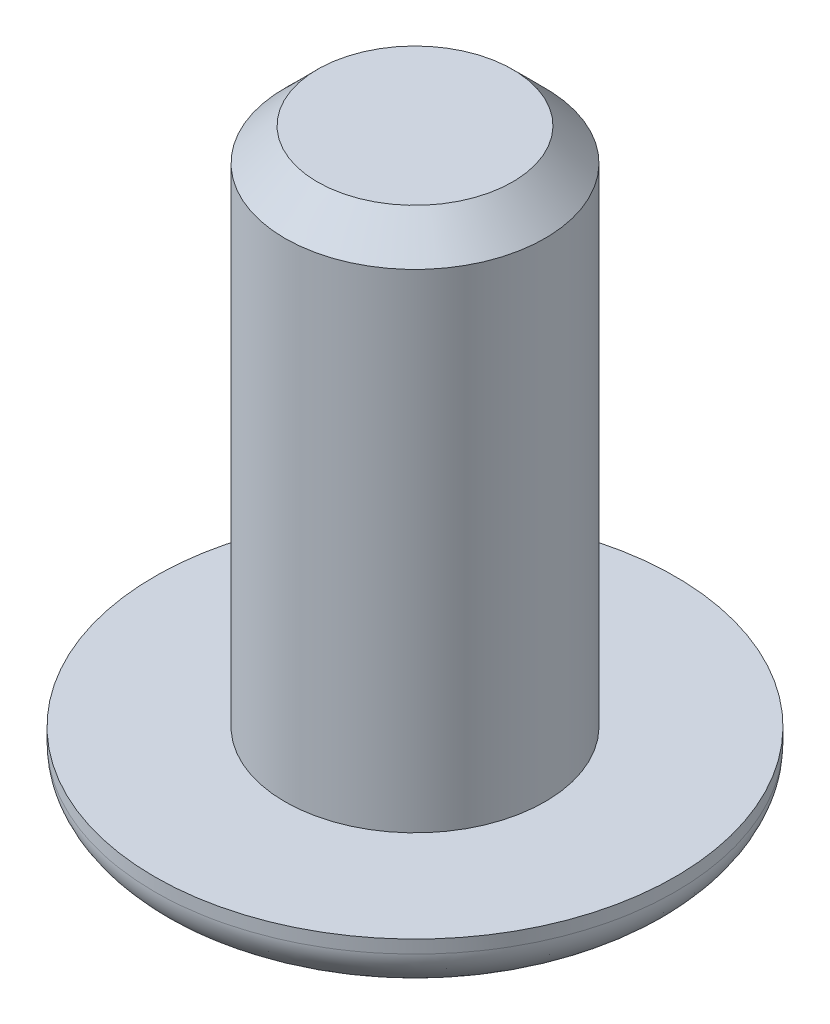
from build123d import *

# Parameters (mm, degrees)
SKETCH_1_R      = 4
EXTRUDE_1_DEPTH = 1.2
SKETCH_2_R      = 2
EXTRUDE_2_DEPTH = 8
CHAMFER_1_SIZE  = 0.5
FILLET_1_SIZE   = 1
FILLET_1_SIZE_2 = 2


with BuildPart() as part:
    # 草图1 → 凸台-拉伸1 (new body)
    with BuildSketch(Plane(origin=(0, 0, 0), x_dir=(1, 0, 0), z_dir=(0, 1, 0))):
        with Locations(Location((0, 0, 0), (0, 0, 270))):
            Circle(SKETCH_1_R)
        Polygon((1.443375673, 0), (0.721687836, 1.25), (-0.721687836, 1.25), (-1.443375673, 0), (-0.721687836, -1.25), (0.721687836, -1.25), align=None, mode=Mode.SUBTRACT)
    extrude(amount=EXTRUDE_1_DEPTH)

    # 草图2 → 凸台-拉伸2 (add)
    with BuildSketch(Plane(origin=(0, 1.2, 0), x_dir=(1, 0, 0), z_dir=(0, 1, 0))):
        with Locations(Location((0, 0, 0), (0, 0, 270))):
            Circle(SKETCH_2_R)
    extrude(amount=EXTRUDE_2_DEPTH)

    # 倒角1
    chamfer_1_edges = [part.edges().sort_by_distance(p)[0] for p in [
        (0, 9.2, -2),
    ]]
    chamfer(chamfer_1_edges, length=CHAMFER_1_SIZE)

    # 圆角1
    # an asymmetric fillet: 2, 1 mm, written as the material it takes off along each edge
    with BuildSketch(Plane(origin=(0, 0, 0), x_dir=(0, 0, 1), z_dir=(-1, 0, 0))) as fillet_1_piece_1:
        with BuildLine():
            Bezier((4, FILLET_1_SIZE), (4, 0), (4 - FILLET_1_SIZE_2, 0), weights=[1, 0.707106781, 1])
            Line((4 - FILLET_1_SIZE_2, 0), (4, 0))
            Line((4, 0), (4, FILLET_1_SIZE))
        make_face()
    revolve(axis=Axis((0, 0, 0), (0, 1, 0)), mode=Mode.SUBTRACT)


solid = part.part
